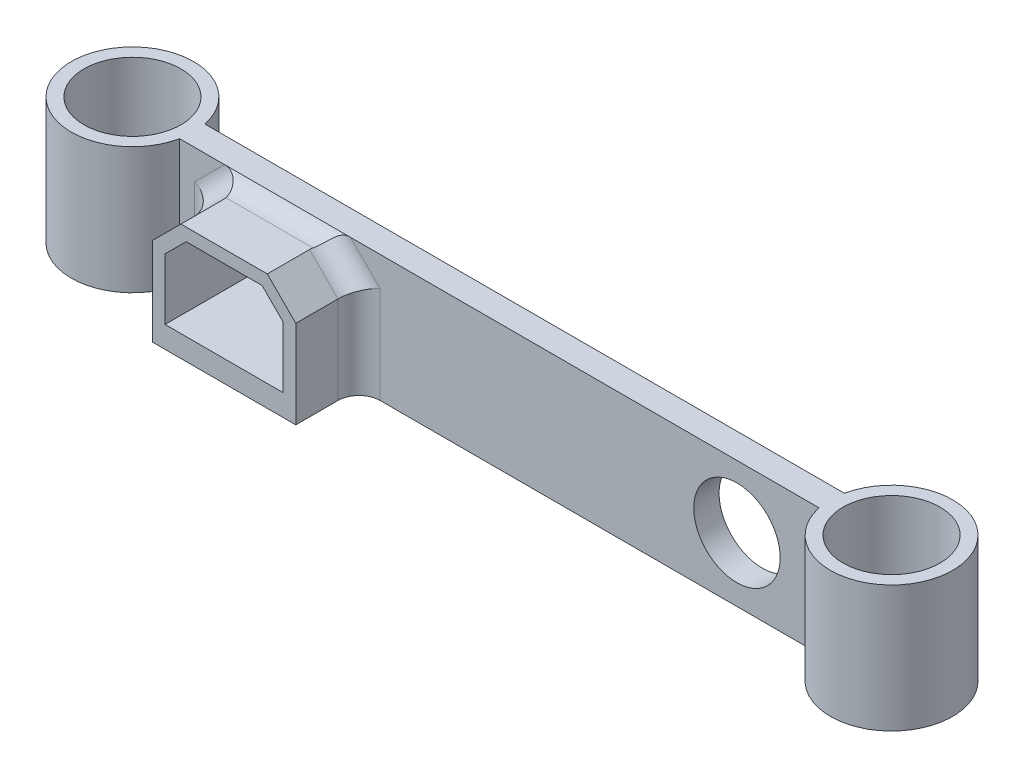
from build123d import *

# Parameters (mm, degrees)
SKETCH1_R           = 11.5
BOSS_EXTRUDE1_DEPTH = 30
CUT_EXTRUDE1_DEPTH  = 10
BOSS_EXTRUDE2_DEPTH = 15
SKETCH4_W           = 34
SKETCH4_H           = 2.123618691
BOSS_EXTRUDE3_DEPTH = 15
FILLET1_R           = 5
SKETCH5_R           = 10.25
CUT_EXTRUDE2_DEPTH  = 15


with BuildPart() as part:
    # Sketch1 → Boss-Extrude1 (new body)
    with BuildSketch(Plane(origin=(0, 0, 0), x_dir=(1, 0, 0), z_dir=(0, 1, 0))):
        with BuildLine():
            Line((-28.353157483, 3), (123.274320599, 3))
            ThreePointArc((123.274320599, 3), (151.960581558, 0), (123.274320599, -3))
            Line((123.274320599, -3), (-28.353157483, -3))
            ThreePointArc((-28.353157483, -3), (-57.039418442, 0), (-28.353157483, 3))
        make_face()
        with Locations(Location((-42.539418442, 0, 0), (0, 0, 270))):
            Circle(SKETCH1_R, mode=Mode.SUBTRACT)
        with Locations(Location((137.460581558, 0, 0), (0, 0, 270))):
            Circle(SKETCH1_R, mode=Mode.SUBTRACT)
    extrude(amount=BOSS_EXTRUDE1_DEPTH)

    # Sketch2 → Cut-Extrude1 (cut)
    with BuildSketch(Plane.XY.offset(3)):
        Polygon((6.198144817, 24.623618691), (-11.801855183, 24.623618691), (-16.801855183, 19.623618691), (-16.801855183, 5.123618691), (11.198144817, 5.123618691), (11.198144817, 19.623618691), align=None)
    extrude(amount=-CUT_EXTRUDE1_DEPTH, mode=Mode.SUBTRACT)

    # Sketch3 → Boss-Extrude2 (add)
    with BuildSketch(Plane.XY.offset(3)):
        Polygon((-13.044495871, 27.623618691), (7.440785504, 27.623618691), (14.198144817, 20.866259379), (14.198144817, 2.123618691), (-19.801855183, 2.123618691), (-19.801855183, 20.866259379), align=None)
        Polygon((-11.801855183, 24.623618691), (-16.801855183, 19.623618691), (-16.801855183, 5.123618691), (11.198144817, 5.123618691), (11.198144817, 19.623618691), (6.198144817, 24.623618691), align=None, mode=Mode.SUBTRACT)
    extrude(amount=BOSS_EXTRUDE2_DEPTH)

    # Sketch4 → Boss-Extrude3 (add)
    with BuildSketch(Plane.XY.offset(3)):
        with Locations((-2.801855183, 1.061809346)):
            Rectangle(SKETCH4_W, SKETCH4_H)
    extrude(amount=BOSS_EXTRUDE3_DEPTH)

    # Fillet1
    # the kernel refuses this fillet: 5 mm, written as the material it adds along each edge
    with BuildSketch(Plane(origin=(-28.640689948, 12.027424614, 3), x_dir=(-0.7071067811865481, 0.7071067811865469, 0), z_dir=(0.707106781186547, 0.7071067811865481, 0))) as fillet1_piece_1_section:
        with BuildLine():
            CenterArc((FILLET1_R, FILLET1_R), FILLET1_R, 180, 90)
            Line((0, FILLET1_R), (0, 0))
            Line((0, 0), (FILLET1_R, 0))
        make_face()
    fillet1_piece_1 = extrude(amount=34.556349186, mode=Mode.PRIVATE)
    fillet1_piece_1 = split(fillet1_piece_1, bisect_by=Plane(origin=(-28.640689948, 27.623618691, 3), z_dir=(0, -1, 0)), keep=Keep.TOP, mode=Mode.PRIVATE)
    fillet1_piece_1 = split(fillet1_piece_1, bisect_by=Plane(origin=(-19.801855183, 12.027424614, 3), z_dir=(1, 0, 0)), keep=Keep.TOP, mode=Mode.PRIVATE)
    add(fillet1_piece_1)
    with BuildSketch(Plane(origin=(-28.640689948, 12.027424614, 3), x_dir=(-0.7071067811865481, 0.7071067811865469, 0), z_dir=(0.707106781186547, 0.7071067811865481, 0))) as fillet1_piece_2_section:
        with BuildLine():
            CenterArc((FILLET1_R, FILLET1_R), FILLET1_R, 180, 90)
            Line((0, FILLET1_R), (0, 0))
            Line((0, 0), (FILLET1_R, 0))
        make_face()
    fillet1_piece_2 = extrude(amount=34.556349186, mode=Mode.PRIVATE)
    fillet1_piece_2 = split(fillet1_piece_2, bisect_by=Plane(origin=(-28.640689948, 27.623618691, 3), z_dir=(0, 1, 0)), keep=Keep.TOP, mode=Mode.PRIVATE)
    fillet1_piece_2 = split(fillet1_piece_2, bisect_by=Plane(origin=(-19.801855183, 12.027424614, 3), z_dir=(-1, 0, 0)), keep=Keep.TOP, mode=Mode.PRIVATE)
    add(fillet1_piece_2)
    with BuildSketch(Plane(origin=(-19.801855183, 0, 3), x_dir=(-1, 0, 0), z_dir=(0, 1, 0))) as fillet1_piece_3_section:
        with BuildLine():
            CenterArc((FILLET1_R, FILLET1_R), FILLET1_R, 180, 90)
            Line((0, FILLET1_R), (0, 0))
            Line((0, 0), (FILLET1_R, 0))
        make_face()
    fillet1_piece_3 = extrude(amount=33.366259379, mode=Mode.PRIVATE)
    fillet1_piece_3 = split(fillet1_piece_3, bisect_by=Plane(origin=(-30.234984873, 10.433129689, 3), z_dir=(0.7071067811865481, -0.707106781186547, 0)), keep=Keep.TOP, mode=Mode.PRIVATE)
    add(fillet1_piece_3)
    with BuildSketch(Plane(origin=(14.198144817, 33.366259379, 3), x_dir=(1, 0, 0), z_dir=(0, -1, 0))) as fillet1_piece_4_section:
        with BuildLine():
            CenterArc((FILLET1_R, FILLET1_R), FILLET1_R, 180, 90)
            Line((0, FILLET1_R), (0, 0))
            Line((0, 0), (FILLET1_R, 0))
        make_face()
    fillet1_piece_4 = extrude(amount=33.366259379, mode=Mode.PRIVATE)
    fillet1_piece_4 = split(fillet1_piece_4, bisect_by=Plane(origin=(7.948144817, 27.116259379, 3), z_dir=(-0.7071067811865476, -0.7071067811865476, 0)), keep=Keep.TOP, mode=Mode.PRIVATE)
    add(fillet1_piece_4)
    with BuildSketch(Plane(origin=(-1.398049261, 36.462453456, 3), x_dir=(0.7071067811865475, 0.7071067811865475, 0), z_dir=(0.7071067811865476, -0.7071067811865476, 0))) as fillet1_piece_5_section:
        with BuildLine():
            CenterArc((FILLET1_R, FILLET1_R), FILLET1_R, 180, 90)
            Line((0, FILLET1_R), (0, 0))
            Line((0, 0), (FILLET1_R, 0))
        make_face()
    fillet1_piece_5 = extrude(amount=34.556349186, mode=Mode.PRIVATE)
    fillet1_piece_5 = split(fillet1_piece_5, bisect_by=Plane(origin=(14.198144817, 36.462453456, 3), z_dir=(-1, 0, 0)), keep=Keep.TOP, mode=Mode.PRIVATE)
    fillet1_piece_5 = split(fillet1_piece_5, bisect_by=Plane(origin=(-1.398049261, 27.623618691, 3), z_dir=(0, -1, 0)), keep=Keep.TOP, mode=Mode.PRIVATE)
    add(fillet1_piece_5)
    with BuildSketch(Plane(origin=(-1.398049261, 36.462453456, 3), x_dir=(0.7071067811865475, 0.7071067811865475, 0), z_dir=(0.7071067811865476, -0.7071067811865476, 0))) as fillet1_piece_6_section:
        with BuildLine():
            CenterArc((FILLET1_R, FILLET1_R), FILLET1_R, 180, 90)
            Line((0, FILLET1_R), (0, 0))
            Line((0, 0), (FILLET1_R, 0))
        make_face()
    fillet1_piece_6 = extrude(amount=34.556349186, mode=Mode.PRIVATE)
    fillet1_piece_6 = split(fillet1_piece_6, bisect_by=Plane(origin=(14.198144817, 36.462453456, 3), z_dir=(1, 0, 0)), keep=Keep.TOP, mode=Mode.PRIVATE)
    fillet1_piece_6 = split(fillet1_piece_6, bisect_by=Plane(origin=(-1.398049261, 27.623618691, 3), z_dir=(0, 1, 0)), keep=Keep.TOP, mode=Mode.PRIVATE)
    add(fillet1_piece_6)
    with BuildSketch(Plane(origin=(-23.685403069, 27.623618691, 3), x_dir=(0, 1, 0), z_dir=(1, 0, 0))) as fillet1_piece_7_section:
        with BuildLine():
            CenterArc((5, 4.256362879), FILLET1_R, 180, 58.350352686)
            Line((0, 4.256362879), (0, 0))
            Line((0, 0), (2.376381309, 0))
        make_face()
    fillet1_piece_7 = extrude(amount=41.767095772, mode=Mode.PRIVATE)
    fillet1_piece_7 = split(fillet1_piece_7, bisect_by=Plane(origin=(-8.122308783, 43.186712978, 3), z_dir=(-0.7071067811865476, -0.7071067811865476, 0)), keep=Keep.TOP, mode=Mode.PRIVATE)
    fillet1_piece_7 = split(fillet1_piece_7, bisect_by=Plane(origin=(-18.36494947, 22.303165092, 3), z_dir=(0.7071067811865481, -0.707106781186547, 0)), keep=Keep.TOP, mode=Mode.PRIVATE)
    add(fillet1_piece_7)
    with BuildSketch(Plane(origin=(-19.801855183, 0, 3), x_dir=(-1, 0, 0), z_dir=(0, 1, 0))) as fillet1_piece_8a_section:
        with BuildLine():
            CenterArc((FILLET1_R, FILLET1_R), FILLET1_R, 180, 90)
            Line((0, FILLET1_R), (0, 0))
            Line((0, 0), (FILLET1_R, 0))
        make_face()
    fillet1_piece_8a = extrude(amount=33.366259379, mode=Mode.PRIVATE)
    fillet1_piece_8a = split(fillet1_piece_8a, bisect_by=Plane(origin=(-30.234984873, 10.433129689, 3), z_dir=(-0.7071067811865481, 0.707106781186547, 0)), keep=Keep.TOP, mode=Mode.PRIVATE)
    fillet1_piece_8a = split(fillet1_piece_8a, bisect_by=Plane(origin=(-19.801855183, 30, 3), z_dir=(0, -1, 0)), keep=Keep.TOP, mode=Mode.PRIVATE)
    with BuildSketch(Plane(origin=(-28.640689948, 12.027424614, 3), x_dir=(-0.7071067811865481, 0.7071067811865469, 0), z_dir=(0.707106781186547, 0.7071067811865481, 0))) as fillet1_piece_8b_section:
        with BuildLine():
            CenterArc((FILLET1_R, FILLET1_R), FILLET1_R, 180, 90)
            Line((0, FILLET1_R), (0, 0))
            Line((0, 0), (FILLET1_R, 0))
        make_face()
    fillet1_piece_8b = extrude(amount=34.556349186, mode=Mode.PRIVATE)
    fillet1_piece_8b = split(fillet1_piece_8b, bisect_by=Plane(origin=(-19.801855183, 12.027424614, 3), z_dir=(-1, 0, 0)), keep=Keep.TOP, mode=Mode.PRIVATE)
    fillet1_piece_8b = fillet1_piece_8b - Plane(origin=(-42.539418442, 12.027424614, 0), x_dir=(0.9783628247662832, 0, 0.20689655172413826), z_dir=(0, -1, 0)) * Cylinder(14.5, 90, mode=Mode.PRIVATE)
    fillet1_piece_8 = fillet1_piece_8a & fillet1_piece_8b
    add(fillet1_piece_8)
    with BuildSketch(Plane(origin=(-28.640689948, 12.027424614, 3), x_dir=(-0.7071067811865481, 0.7071067811865469, 0), z_dir=(0.707106781186547, 0.7071067811865481, 0))) as fillet1_piece_9a_section:
        with BuildLine():
            CenterArc((FILLET1_R, FILLET1_R), FILLET1_R, 180, 90)
            Line((0, FILLET1_R), (0, 0))
            Line((0, 0), (FILLET1_R, 0))
        make_face()
    fillet1_piece_9a = extrude(amount=34.556349186, mode=Mode.PRIVATE)
    fillet1_piece_9a = split(fillet1_piece_9a, bisect_by=Plane(origin=(-28.640689948, 27.623618691, 3), z_dir=(0, 1, 0)), keep=Keep.TOP, mode=Mode.PRIVATE)
    fillet1_piece_9a = split(fillet1_piece_9a, bisect_by=Plane(origin=(-28.640689948, 30, 3), z_dir=(0, -1, 0)), keep=Keep.TOP, mode=Mode.PRIVATE)
    with BuildSketch(Plane(origin=(-23.685403069, 27.623618691, 3), x_dir=(0, 1, 0), z_dir=(1, 0, 0))) as fillet1_piece_9b_section:
        with BuildLine():
            CenterArc((5, 4.256362879), FILLET1_R, 180, 58.350352686)
            Line((0, 4.256362879), (0, 0))
            Line((0, 0), (2.376381309, 0))
        make_face()
    fillet1_piece_9b = extrude(amount=41.767095772, mode=Mode.PRIVATE)
    fillet1_piece_9b = split(fillet1_piece_9b, bisect_by=Plane(origin=(-18.36494947, 22.303165092, 3), z_dir=(-0.7071067811865481, 0.707106781186547, 0)), keep=Keep.TOP, mode=Mode.PRIVATE)
    fillet1_piece_9 = fillet1_piece_9a & fillet1_piece_9b
    add(fillet1_piece_9)
    with BuildSketch(Plane(origin=(-1.398049261, 36.462453456, 3), x_dir=(0.7071067811865475, 0.7071067811865475, 0), z_dir=(0.7071067811865476, -0.7071067811865476, 0))) as fillet1_piece_10a_section:
        with BuildLine():
            CenterArc((FILLET1_R, FILLET1_R), FILLET1_R, 180, 90)
            Line((0, FILLET1_R), (0, 0))
            Line((0, 0), (FILLET1_R, 0))
        make_face()
    fillet1_piece_10a = extrude(amount=34.556349186, mode=Mode.PRIVATE)
    fillet1_piece_10a = split(fillet1_piece_10a, bisect_by=Plane(origin=(14.198144817, 36.462453456, 3), z_dir=(1, 0, 0)), keep=Keep.TOP, mode=Mode.PRIVATE)
    with BuildSketch(Plane(origin=(14.198144817, 33.366259379, 3), x_dir=(1, 0, 0), z_dir=(0, -1, 0))) as fillet1_piece_10b_section:
        with BuildLine():
            CenterArc((FILLET1_R, FILLET1_R), FILLET1_R, 180, 90)
            Line((0, FILLET1_R), (0, 0))
            Line((0, 0), (FILLET1_R, 0))
        make_face()
    fillet1_piece_10b = extrude(amount=33.366259379, mode=Mode.PRIVATE)
    fillet1_piece_10b = split(fillet1_piece_10b, bisect_by=Plane(origin=(7.948144817, 27.116259379, 3), z_dir=(0.7071067811865476, 0.7071067811865476, 0)), keep=Keep.TOP, mode=Mode.PRIVATE)
    fillet1_piece_10b = split(fillet1_piece_10b, bisect_by=Plane(origin=(14.198144817, 30, 3), z_dir=(0, -1, 0)), keep=Keep.TOP, mode=Mode.PRIVATE)
    fillet1_piece_10 = fillet1_piece_10a & fillet1_piece_10b
    add(fillet1_piece_10)
    with BuildSketch(Plane(origin=(-23.685403069, 27.623618691, 3), x_dir=(0, 1, 0), z_dir=(1, 0, 0))) as fillet1_piece_11a_section:
        with BuildLine():
            CenterArc((5, 4.256362879), FILLET1_R, 180, 58.350352686)
            Line((0, 4.256362879), (0, 0))
            Line((0, 0), (2.376381309, 0))
        make_face()
    fillet1_piece_11a = extrude(amount=41.767095772, mode=Mode.PRIVATE)
    fillet1_piece_11a = split(fillet1_piece_11a, bisect_by=Plane(origin=(-8.122308783, 43.186712978, 3), z_dir=(0.7071067811865476, 0.7071067811865476, 0)), keep=Keep.TOP, mode=Mode.PRIVATE)
    with BuildSketch(Plane(origin=(-1.398049261, 36.462453456, 3), x_dir=(0.7071067811865475, 0.7071067811865475, 0), z_dir=(0.7071067811865476, -0.7071067811865476, 0))) as fillet1_piece_11b_section:
        with BuildLine():
            CenterArc((FILLET1_R, FILLET1_R), FILLET1_R, 180, 90)
            Line((0, FILLET1_R), (0, 0))
            Line((0, 0), (FILLET1_R, 0))
        make_face()
    fillet1_piece_11b = extrude(amount=34.556349186, mode=Mode.PRIVATE)
    fillet1_piece_11b = split(fillet1_piece_11b, bisect_by=Plane(origin=(-1.398049261, 27.623618691, 3), z_dir=(0, 1, 0)), keep=Keep.TOP, mode=Mode.PRIVATE)
    fillet1_piece_11b = split(fillet1_piece_11b, bisect_by=Plane(origin=(-1.398049261, 30, 3), z_dir=(0, -1, 0)), keep=Keep.TOP, mode=Mode.PRIVATE)
    fillet1_piece_11 = fillet1_piece_11a & fillet1_piece_11b
    add(fillet1_piece_11)

    # Sketch5 → Cut-Extrude2 (cut)
    with BuildSketch(Plane(origin=(0, 0, -3), x_dir=(-1, 0, 0), z_dir=(0, 0, -1))):
        with Locations((-103.805830626, 15.139955724)):
            Circle(SKETCH5_R)
    extrude(amount=-CUT_EXTRUDE2_DEPTH, mode=Mode.SUBTRACT)


solid = part.part
